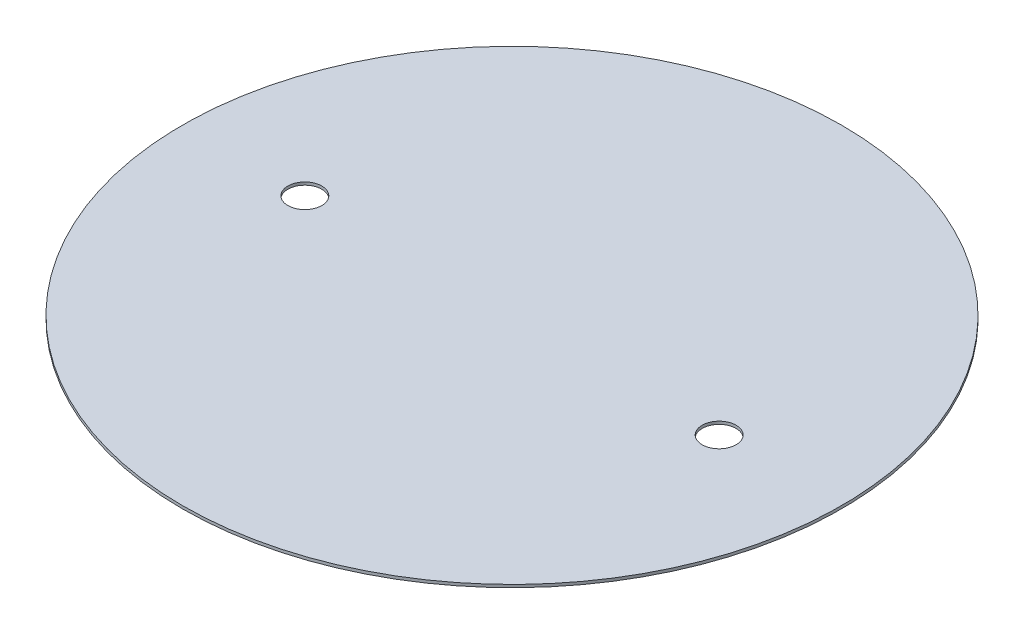
from build123d import *

# Parameters (mm, degrees)
SKETCH1_R           = 1750
BOSS_EXTRUDE1_DEPTH = 15
SKETCH2_R           = 90
CUT_EXTRUDE1_DEPTH  = 50


with BuildPart() as part:
    # Sketch1 → Boss-Extrude1 (new body)
    with BuildSketch(Plane(origin=(0, 0, 0), x_dir=(1, 0, 0), z_dir=(0, 1, 0))):
        Circle(SKETCH1_R)
    extrude(amount=BOSS_EXTRUDE1_DEPTH)

    # Sketch2 → Cut-Extrude1 (cut)
    with BuildSketch(Plane(origin=(0, 15, 0), x_dir=(1, 0, 0), z_dir=(0, 1, 0))):
        with Locations((-1100, 0)):
            Circle(SKETCH2_R)
        with Locations((1100, 0)):
            Circle(SKETCH2_R)
    extrude(amount=-CUT_EXTRUDE1_DEPTH, mode=Mode.SUBTRACT)


solid = part.part
